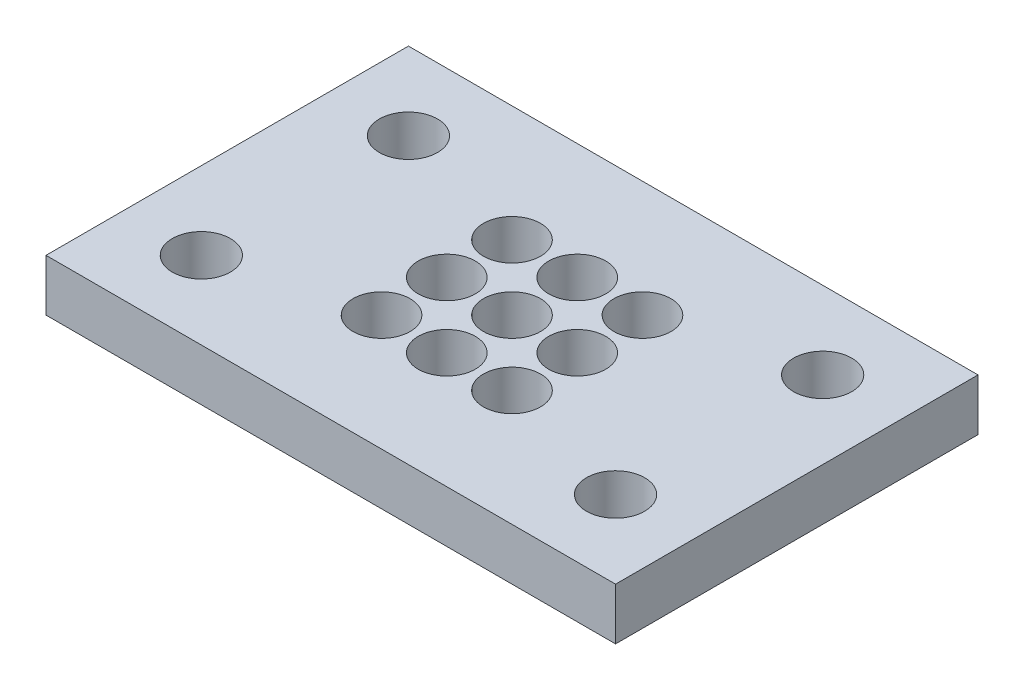
from build123d import *

# Parameters (mm, degrees)
SKETCH1_W           = 69.85
SKETCH1_H           = 44.45
SKETCH1_R           = 3.5687
SKETCH1_R_2         = 3.5
BOSS_EXTRUDE1_DEPTH = 6.35


with BuildPart() as part:
    # Sketch1 → Boss-Extrude1 (new body)
    with BuildSketch(Plane(origin=(0, 0, 0), x_dir=(1, 0, 0), z_dir=(0, 1, 0))):
        with Locations((34.925, 22.225)):
            Rectangle(SKETCH1_W, SKETCH1_H)
        with Locations((9.525, 9.525)):
            Circle(SKETCH1_R, mode=Mode.SUBTRACT)
        with Locations((26.925, 14.225)):
            Circle(SKETCH1_R_2, mode=Mode.SUBTRACT)
        with Locations((26.925, 22.225)):
            Circle(SKETCH1_R_2, mode=Mode.SUBTRACT)
        with Locations((60.325, 9.525)):
            Circle(SKETCH1_R, mode=Mode.SUBTRACT)
        with Locations((34.925, 14.225)):
            Circle(SKETCH1_R_2, mode=Mode.SUBTRACT)
        with Locations((42.925, 14.225)):
            Circle(SKETCH1_R_2, mode=Mode.SUBTRACT)
        with Locations((26.925, 30.225)):
            Circle(SKETCH1_R_2, mode=Mode.SUBTRACT)
        with Locations((34.925, 30.225)):
            Circle(SKETCH1_R_2, mode=Mode.SUBTRACT)
        with Locations((9.525, 34.925)):
            Circle(SKETCH1_R, mode=Mode.SUBTRACT)
        with Locations((34.925, 22.225)):
            Circle(SKETCH1_R_2, mode=Mode.SUBTRACT)
        with Locations((42.925, 22.225)):
            Circle(SKETCH1_R_2, mode=Mode.SUBTRACT)
        with Locations((42.925, 30.225)):
            Circle(SKETCH1_R_2, mode=Mode.SUBTRACT)
        with Locations((60.325, 34.925)):
            Circle(SKETCH1_R, mode=Mode.SUBTRACT)
    extrude(amount=BOSS_EXTRUDE1_DEPTH)


solid = part.part
